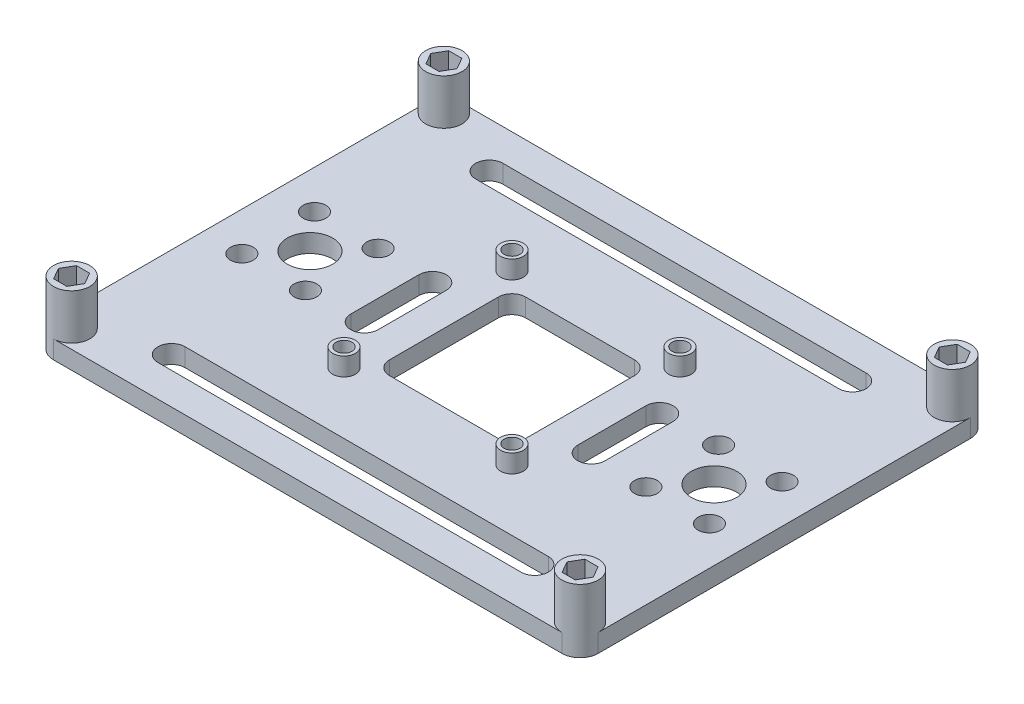
from build123d import *

# Parameters (mm, degrees)
SKETCH1_W               = 120
SKETCH1_H               = 90
SKETCH1_R               = 2.5
SKETCH1_R_2             = 5
BOSS_EXTRUDE1_DEPTH     = 4
FILLET1_R               = 4
BOSS_EXTRUDE2_START     = 10
SKETCH2_R               = 4
BOSS_EXTRUDE2_DEPTH     = 10
MIRROR2_START           = 10
MIRROR2_COPY_1_SKETCH_R = 4
MIRROR2_COPY_1_DEPTH    = 10
MIRROR2_COPY_2_SKETCH_R = 4
MIRROR2_COPY_2_DEPTH    = 10
SKETCH3_R               = 1.75
CUT_EXTRUDE1_DEPTH      = 4
MIRROR4_COPY_1_SKETCH_R = 1.75
MIRROR4_COPY_1_DEPTH    = 4
MIRROR4_COPY_2_SKETCH_R = 1.75
MIRROR4_COPY_2_DEPTH    = 4
SKETCH4_R               = 2.5
BOSS_EXTRUDE3_DEPTH     = 4
SKETCH5_R               = 1.75
CUT_EXTRUDE2_DEPTH      = 10
MIRROR6_COPY_1_SKETCH_R = 1.75
MIRROR6_COPY_1_DEPTH    = 10
MIRROR6_COPY_2_SKETCH_R = 1.75
MIRROR6_COPY_2_DEPTH    = 10
CUT_EXTRUDE3_DEPTH      = 10


with BuildPart() as part:
    # Sketch1 → Boss-Extrude1 (new body)
    with BuildSketch(Plane(origin=(0, 0, 0), x_dir=(1, 0, 0), z_dir=(0, 1, 0))):
        Rectangle(SKETCH1_W, SKETCH1_H)
        with Locations((-51.5, 8)):
            Circle(SKETCH1_R, mode=Mode.SUBTRACT)
        with Locations((-44.5, 0)):
            Circle(SKETCH1_R_2, mode=Mode.SUBTRACT)
        with Locations((-37.5, 8)):
            Circle(SKETCH1_R, mode=Mode.SUBTRACT)
        with Locations((-51.5, -8)):
            Circle(SKETCH1_R, mode=Mode.SUBTRACT)
        with Locations((-37.5, -8)):
            Circle(SKETCH1_R, mode=Mode.SUBTRACT)
        with Locations((44.5, 0)):
            Circle(SKETCH1_R_2, mode=Mode.SUBTRACT)
        with Locations((37.5, 8)):
            Circle(SKETCH1_R, mode=Mode.SUBTRACT)
        with Locations((51.5, 8)):
            Circle(SKETCH1_R, mode=Mode.SUBTRACT)
        with Locations((37.5, -8)):
            Circle(SKETCH1_R, mode=Mode.SUBTRACT)
        with Locations((51.5, -8)):
            Circle(SKETCH1_R, mode=Mode.SUBTRACT)
    extrude(amount=BOSS_EXTRUDE1_DEPTH)

    # Fillet1
    fillet1_edges = [part.edges().sort_by_distance(p)[0] for p in [
        (-60, 2, 45),
        (-60, 2, -45),
        (60, 2, -45),
        (60, 2, 45),
    ]]
    fillet(fillet1_edges, radius=FILLET1_R)

    # Sketch2 → Boss-Extrude2 (add)
    with BuildSketch(Plane(origin=(0, 4, 0), x_dir=(1, 0, 0), z_dir=(0, 1, 0)).offset(BOSS_EXTRUDE2_START)):
        with Locations((-56, 41)):
            Circle(SKETCH2_R)
        Polygon((-53.1, 41), (-54.55, 43.511473671), (-57.45, 43.511473671), (-58.9, 41), (-57.45, 38.488526329), (-54.55, 38.488526329), align=None, mode=Mode.SUBTRACT)
    boss_extrude2 = extrude(amount=-BOSS_EXTRUDE2_DEPTH)

    # Mirror1: Boss-Extrude2 across plane
    add(boss_extrude2.mirror(Plane.XY))

    # Mirror2 copy 1 sketch → Mirror2 copy 1 (add)
    with BuildSketch(Plane(origin=(0, 4, 0), x_dir=(-1, 0, 0), z_dir=(0, 1, 0)).offset(MIRROR2_START)):
        with Locations((-56, 41)):
            Circle(MIRROR2_COPY_1_SKETCH_R)
        Polygon((-53.1, 41), (-54.55, 43.511473671), (-57.45, 43.511473671), (-58.9, 41), (-57.45, 38.488526329), (-54.55, 38.488526329), align=None, mode=Mode.SUBTRACT)
    extrude(amount=-MIRROR2_COPY_1_DEPTH)

    # Mirror2 copy 2 sketch → Mirror2 copy 2 (add)
    with BuildSketch(Plane(origin=(0, 4, 0), x_dir=(-1, 0, 0), z_dir=(0, 1, 0)).offset(MIRROR2_START)):
        with Locations((-56, -41)):
            Circle(MIRROR2_COPY_2_SKETCH_R)
        Polygon((-53.1, -41), (-54.55, -43.511473671), (-57.45, -43.511473671), (-58.9, -41), (-57.45, -38.488526329), (-54.55, -38.488526329), align=None, mode=Mode.SUBTRACT)
    extrude(amount=-MIRROR2_COPY_2_DEPTH)

    # Sketch3 → Cut-Extrude1 (cut)
    with BuildSketch(Plane(origin=(0, 4, 0), x_dir=(1, 0, 0), z_dir=(0, 1, 0))):
        with Locations((-56, 41)):
            Circle(SKETCH3_R)
    cut_extrude1 = extrude(amount=-CUT_EXTRUDE1_DEPTH, mode=Mode.SUBTRACT)

    # Mirror3: Cut-Extrude1 across plane
    add(cut_extrude1.mirror(Plane(origin=(0, 0, 0), x_dir=(0, 0, 1), z_dir=(1, 0, 0))), mode=Mode.SUBTRACT)

    # Mirror4 copy 1 sketch → Mirror4 copy 1 (cut)
    with BuildSketch(Plane(origin=(0, 4, 0), x_dir=(-1, 0, 0), z_dir=(0, 1, 0))):
        with Locations((-56, 41)):
            Circle(MIRROR4_COPY_1_SKETCH_R)
    extrude(amount=-MIRROR4_COPY_1_DEPTH, mode=Mode.SUBTRACT)

    # Mirror4 copy 2 sketch → Mirror4 copy 2 (cut)
    with BuildSketch(Plane(origin=(0, 4, 0), x_dir=(1, 0, 0), z_dir=(0, 1, 0))):
        with Locations((-56, -41)):
            Circle(MIRROR4_COPY_2_SKETCH_R)
    extrude(amount=-MIRROR4_COPY_2_DEPTH, mode=Mode.SUBTRACT)

    # Sketch4 → Boss-Extrude3 (add)
    with BuildSketch(Plane(origin=(0, 4, 0), x_dir=(1, 0, 0), z_dir=(0, 1, 0))):
        with Locations((-18.5, 18.5)):
            Circle(SKETCH4_R)
        with Locations((18.5, 18.5)):
            Circle(SKETCH4_R)
        with Locations((18.5, -18.5)):
            Circle(SKETCH4_R)
        with Locations((-18.5, -18.5)):
            Circle(SKETCH4_R)
    extrude(amount=BOSS_EXTRUDE3_DEPTH)

    # Sketch5 → Cut-Extrude2 (cut)
    with BuildSketch(Plane(origin=(0, 8, 0), x_dir=(1, 0, 0), z_dir=(0, 1, 0))):
        with Locations((-18.5, 18.5)):
            Circle(SKETCH5_R)
    cut_extrude2 = extrude(amount=-CUT_EXTRUDE2_DEPTH, mode=Mode.SUBTRACT)

    # Mirror5: Cut-Extrude2 across plane
    add(cut_extrude2.mirror(Plane(origin=(0, 0, 0), x_dir=(0, 0, 1), z_dir=(1, 0, 0))), mode=Mode.SUBTRACT)

    # Mirror6 copy 1 sketch → Mirror6 copy 1 (cut)
    with BuildSketch(Plane(origin=(0, 8, 0), x_dir=(-1, 0, 0), z_dir=(0, 1, 0))):
        with Locations((-18.5, 18.5)):
            Circle(MIRROR6_COPY_1_SKETCH_R)
    extrude(amount=-MIRROR6_COPY_1_DEPTH, mode=Mode.SUBTRACT)

    # Mirror6 copy 2 sketch → Mirror6 copy 2 (cut)
    with BuildSketch(Plane(origin=(0, 8, 0), x_dir=(1, 0, 0), z_dir=(0, 1, 0))):
        with Locations((-18.5, -18.5)):
            Circle(MIRROR6_COPY_2_SKETCH_R)
    extrude(amount=-MIRROR6_COPY_2_DEPTH, mode=Mode.SUBTRACT)

    # Sketch6 → Cut-Extrude3 (cut)
    with BuildSketch(Plane(origin=(0, 4, 0), x_dir=(1, 0, 0), z_dir=(0, 1, 0))):
        with BuildLine():
            Line((-12, -15), (12, -15))
            ThreePointArc((12, -15), (14.121320344, -14.121320344), (15, -12))
            Line((15, -12), (15, 12))
            ThreePointArc((15, 12), (14.121320344, 14.121320344), (12, 15))
            Line((12, 15), (-12, 15))
            ThreePointArc((-12, 15), (-14.121320344, 14.121320344), (-15, 12))
            Line((-15, 12), (-15, -12))
            ThreePointArc((-15, -12), (-14.121320344, -14.121320344), (-12, -15))
        make_face()
        with BuildLine():
            Line((-28, -7.5), (-28, 7.5))
            ThreePointArc((-28, 7.5), (-25, 10.5), (-22, 7.5))
            Line((-22, 7.5), (-22, -7.5))
            ThreePointArc((-22, -7.5), (-25, -10.5), (-28, -7.5))
        make_face()
        with BuildLine():
            Line((28, -7.5), (28, 7.5))
            ThreePointArc((28, 7.5), (25, 10.5), (22, 7.5))
            Line((22, 7.5), (22, -7.5))
            ThreePointArc((22, -7.5), (25, -10.5), (28, -7.5))
        make_face()
        with BuildLine():
            Line((-40, 38), (40, 38))
            ThreePointArc((40, 38), (43, 35), (40, 32))
            Line((40, 32), (-40, 32))
            ThreePointArc((-40, 32), (-43, 35), (-40, 38))
        make_face()
        with BuildLine():
            Line((-40, -38), (40, -38))
            ThreePointArc((40, -38), (43, -35), (40, -32))
            Line((40, -32), (-40, -32))
            ThreePointArc((-40, -32), (-43, -35), (-40, -38))
        make_face()
    extrude(amount=-CUT_EXTRUDE3_DEPTH, mode=Mode.SUBTRACT)


solid = part.part
